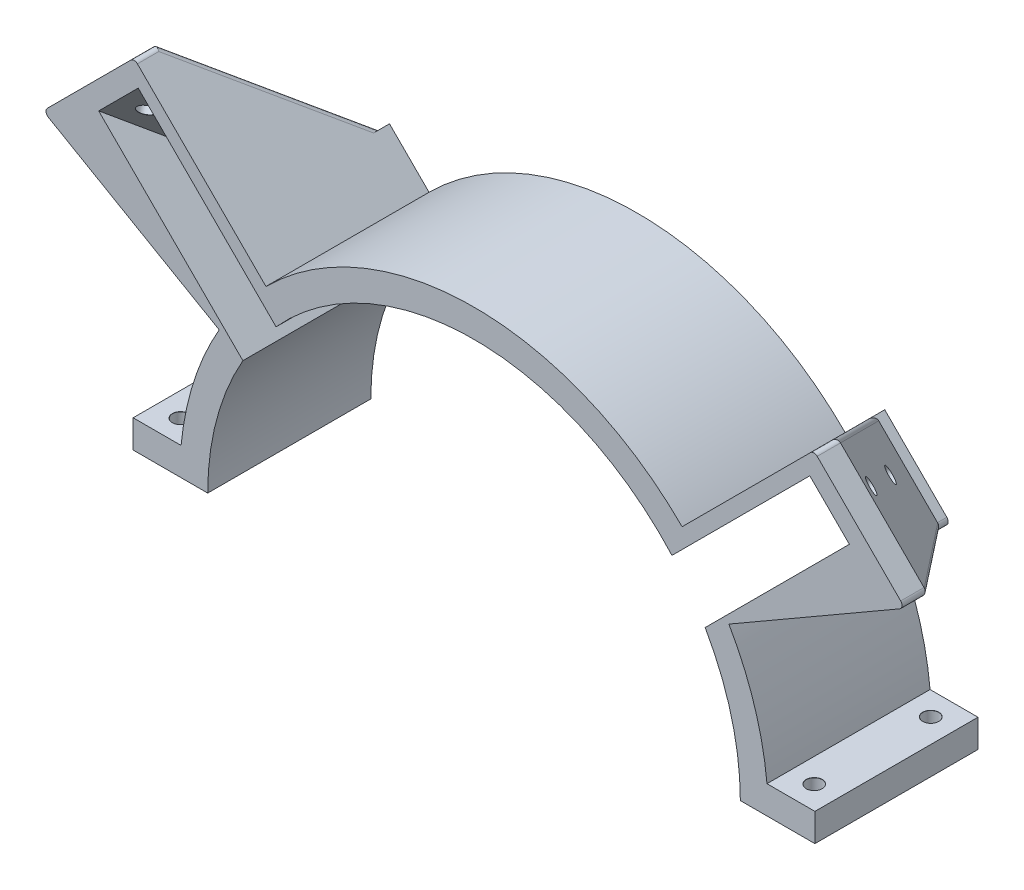
from build123d import *

# Parameters (mm, degrees)
EXTRUDE_1_DEPTH     = 35
EXTRUDE_START       = -35
EXTRUDE_2_DEPTH     = 35
CUT_EXTRUDE_1_DEPTH = 123.873256546
SKETCH_4_W          = 12
SKETCH_4_H          = 35
CUT_EXTRUDE_4_DEPTH = 165.71136734
FILLET_1_R          = 1
FILLET_2_R          = 1
SKETCH_5_W          = 13
SKETCH_5_H          = 6
EXTRUDE_4_DEPTH     = 35


# Read off the part's stored shape, not the designer's step: M3 すきま穴1, M3 すきま穴2
with BuildPart() as part:
    # ｽｹｯﾁ1 → ﾎﾞｽ - 押し出し1 (new body)
    with BuildSketch(Plane.XY):
        with BuildLine():
            Line((57.15, 0), (63.15, 0))
            ThreePointArc((63.15, 0), (0, 63.15), (-63.15, 0))
            Line((-63.15, 0), (-57.15, 0))
            ThreePointArc((-57.15, 0), (0, 57.15), (57.15, 0))
        make_face()
    extrude(amount=EXTRUDE_1_DEPTH)

    # ｽｹｯﾁ2 → ﾎﾞｽ - 押し出し2 (add)
    with BuildSketch(Plane.XY.offset(35).offset(EXTRUDE_START)):
        with BuildLine():
            Line((-44.653793232, 44.653793232), (-72.938064479, 72.938064479))
            Line((-72.938064479, 72.938064479), (-92.481759954, 53.394369005))
            Line((-92.481759954, 53.394369005), (-54.689504249, 31.575))
            ThreePointArc((-54.689504249, 31.575), (-50.100263439, 38.443284242), (-44.653793232, 44.653793232))
        make_face()
    extrude_2 = extrude(amount=EXTRUDE_2_DEPTH)

    # ｽｹｯﾁ3 → ｶｯﾄ - 押し出し1 (cut, through all)
    with BuildSketch(Plane(origin=(0, 0, 0), x_dir=(0, 0, -1), z_dir=(0.7071067811865461, 0.7071067811865489, 0))):
        Polygon((-30, 103.15), (-2, 75.15), (0, 75.15), (0, 103.15), align=None)
    cut_extrude_1 = extrude(amount=-CUT_EXTRUDE_1_DEPTH, mode=Mode.SUBTRACT)

    # ﾐﾗｰ1: ﾎﾞｽ - 押し出し2, ｶｯﾄ - 押し出し1 across plane
    add(extrude_2.mirror(Plane(origin=(0, 0, 0), x_dir=(0, 0, 1), z_dir=(1, 0, 0))))
    add(cut_extrude_1.mirror(Plane(origin=(0, 0, 0), x_dir=(0, 0, 1), z_dir=(1, 0, 0))), mode=Mode.SUBTRACT)

    # ｽｹｯﾁ4 → ｶｯﾄ - 押し出し4 (cut, through all)
    with BuildSketch(Plane(origin=(-48.84340091, 48.84340091, 69.075), x_dir=(-0.707106781186546, -0.707106781186549, 0), z_dir=(0.5000000000000019, -0.4999999999999998, -0.7071067811865465))):
        with Locations((9, 27.689327138)):
            Rectangle(SKETCH_4_W, SKETCH_4_H)
    cut_extrude_4 = extrude(amount=CUT_EXTRUDE_4_DEPTH, mode=Mode.SUBTRACT)

    # ﾌｨﾚｯﾄ1
    fillet_1_edges = [part.edges().sort_by_distance(p)[0] for p in [
        (-72.938064479, 72.938064479, 32.5),
        (-92.481759954, 53.394369005, 32.5),
        (-67.377646733, 38.900502479, 1),
        (-79.929703344, 46.147435742, 16),
        (-63.038569543, 63.038569543, 16),
    ]]
    fillet(fillet_1_edges, radius=FILLET_1_R)

    # ﾐﾗｰ3: ｶｯﾄ - 押し出し4 across plane
    add(cut_extrude_4.mirror(Plane(origin=(0, 0, 0), x_dir=(0, 0, 1), z_dir=(1, 0, 0))), mode=Mode.SUBTRACT)

    # ﾌｨﾚｯﾄ2
    fillet_2_edges = [part.edges().sort_by_distance(p)[0] for p in [
        (72.938064479, 72.938064479, 32.5),
        (92.481759954, 53.394369005, 32.5),
        (63.038569543, 63.038569543, 16),
        (79.929703344, 46.147435742, 16),
        (67.377646733, 38.900502479, 1),
    ]]
    fillet(fillet_2_edges, radius=FILLET_2_R)

    # ｽｹｯﾁ5 → ﾎﾞｽ - 押し出し4 (add)
    with BuildSketch(Plane.XY.offset(35)):
        with Locations((-66.65, 3)):
            Rectangle(SKETCH_5_W, SKETCH_5_H)
        with Locations((66.65, 3)):
            Rectangle(SKETCH_5_W, SKETCH_5_H)
    extrude(amount=-EXTRUDE_4_DEPTH)

    # M3 すきま穴1 outline → M3 すきま穴1 (revolve, cut)
    with BuildSketch(Plane(origin=(68.007159089, 0, 30), x_dir=(1, 0, 0), z_dir=(0, 0, 1))):
        Polygon((0, 0), (1.7, 0), (1.7, 5.97124079), (1.725, 6), (0, 6), align=None)
    revolve(axis=Axis((68.007159089, 0, 30), (0, 1, 0)), mode=Mode.SUBTRACT)

    # Hole Wizard M3 _1 2 outline → Hole Wizard M3 _1 2 (revolve, cut)
    with BuildSketch(Plane(origin=(68.007159089, 0, 5), x_dir=(1, 0, 0), z_dir=(0, 0, 1))):
        Polygon((0, 0), (1.7, 0), (1.7, 5.97124079), (1.725, 6), (0, 6), align=None)
    revolve(axis=Axis((68.007159089, 0, 5), (0, 1, 0)), mode=Mode.SUBTRACT)

    # Hole Wizard M3 _1 3 outline → Hole Wizard M3 _1 3 (revolve, cut)
    with BuildSketch(Plane(origin=(-68.007159089, 0, 30), x_dir=(1, 0, 0), z_dir=(0, 0, 1))):
        Polygon((0, 0), (1.7, 0), (1.7, 5.97124079), (1.725, 6), (0, 6), align=None)
    revolve(axis=Axis((-68.007159089, 0, 30), (0, 1, 0)), mode=Mode.SUBTRACT)

    # Hole Wizard M3 _1 4 outline → Hole Wizard M3 _1 4 (revolve, cut)
    with BuildSketch(Plane(origin=(-68.007159089, 0, 5), x_dir=(1, 0, 0), z_dir=(0, 0, 1))):
        Polygon((0, 0), (1.7, 0), (1.7, 5.97124079), (1.725, 6), (0, 6), align=None)
    revolve(axis=Axis((-68.007159089, 0, 5), (0, 1, 0)), mode=Mode.SUBTRACT)

    # M3 すきま穴2 outline → M3 すきま穴2 (revolve, cut)
    with BuildSketch(Plane(origin=(-41.207361941, 28.47943988, 49.276010127), x_dir=(0.8660254037844382, 0.28867513459481287, -0.4082482904638642), z_dir=(0, -0.8164965809277269, -0.5773502691896247))):
        Polygon((0, -51.724861044), (1.7, -51.724861044), (1.7, -45.218086348), (1.725, -45.189327138), (0, -45.189327138), align=None)
    hole_wizard_m3_2 = revolve(axis=Axis((-41.207361941, 28.47943988, 49.276010127), (0.500000000000001, -0.49999999999999883, 0.7071067811865479)), mode=Mode.SUBTRACT)

    # Hole Wizard M3 _2 2 outline → Hole Wizard M3 _2 2 (revolve, cut)
    with BuildSketch(Plane(origin=(-51.207361941, 38.47943988, 63.418145751), x_dir=(0.8660254037844382, 0.28867513459481287, -0.4082482904638642), z_dir=(0, -0.8164965809277269, -0.5773502691896247))):
        Polygon((0, -51.724861044), (1.7, -51.724861044), (1.7, -45.218086348), (1.725, -45.189327138), (0, -45.189327138), align=None)
    hole_wizard_m3_2_2 = revolve(axis=Axis((-51.207361941, 38.47943988, 63.418145751), (0.500000000000001, -0.49999999999999883, 0.7071067811865479)), mode=Mode.SUBTRACT)

    # ﾐﾗｰ5: M3 すきま穴2, Hole Wizard M3 _2 2 across plane
    add(hole_wizard_m3_2.mirror(Plane(origin=(0, 0, 0), x_dir=(0, 0, 1), z_dir=(1, 0, 0))), mode=Mode.SUBTRACT)
    add(hole_wizard_m3_2_2.mirror(Plane(origin=(0, 0, 0), x_dir=(0, 0, 1), z_dir=(1, 0, 0))), mode=Mode.SUBTRACT)


solid = part.part
